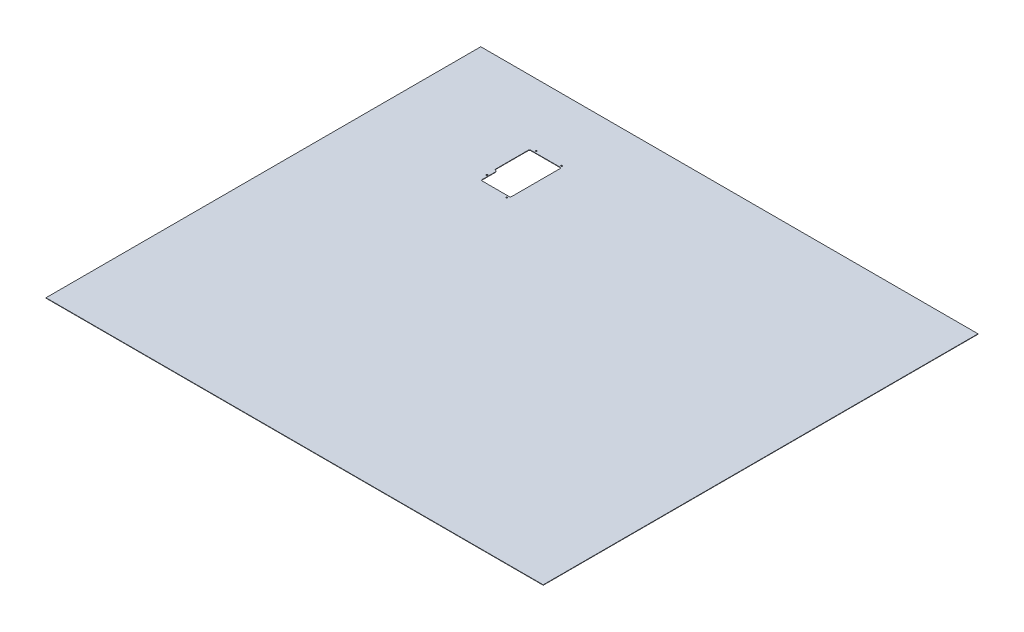
from build123d import *

# Parameters (mm, degrees)
SKETCH1_W           = 1250
SKETCH1_H           = 1093
BOSS_EXTRUDE1_DEPTH = 1
CUT_EXTRUDE1_DEPTH  = 10
FILLET2_R           = 3
SKETCH3_R           = 1.75
CUT_EXTRUDE2_DEPTH  = 10


with BuildPart() as part:
    # Sketch1 → Boss-Extrude1 (new body)
    with BuildSketch(Plane(origin=(0, 0, 0), x_dir=(1, 0, 0), z_dir=(0, 1, 0))):
        Rectangle(SKETCH1_W, SKETCH1_H)
    extrude(amount=BOSS_EXTRUDE1_DEPTH)

    # Sketch2 → Cut-Extrude1 (cut)
    with BuildSketch(Plane(origin=(0, 1, 0), x_dir=(1, 0, 0), z_dir=(0, 1, 0))):
        Polygon((-334, 256), (-260, 256), (-260, 384), (-340, 384), (-340, 296), (-334, 296), align=None)
    extrude(amount=-CUT_EXTRUDE1_DEPTH, mode=Mode.SUBTRACT)

    # Fillet2
    fillet2_edges = [part.edges().sort_by_distance(p)[0] for p in [
        (-260, 0.5, -256),
        (-334, 0.5, -256),
        (-334, 0.5, -296),
        (-340, 0.5, -296),
        (-340, 0.5, -384),
        (-260, 0.5, -384),
    ]]
    fillet(fillet2_edges, radius=FILLET2_R - 0.0001)  # a hair under: the kernel refuses the full size

    # Sketch3 → Cut-Extrude2 (cut)
    with BuildSketch(Plane(origin=(0, 1, 0), x_dir=(1, 0, 0), z_dir=(0, 1, 0))):
        with Locations(Location((-264, 389, 0), (0, 0, 270))):
            Circle(SKETCH3_R)
        with Locations(Location((-328, 389, 0), (0, 0, 270))):
            Circle(SKETCH3_R)
        with Locations(Location((-338, 275, 0), (0, 0, 270))):
            Circle(SKETCH3_R)
        with Locations(Location((-264, 251, 0), (0, 0, 270))):
            Circle(SKETCH3_R)
    extrude(amount=-CUT_EXTRUDE2_DEPTH, mode=Mode.SUBTRACT)


solid = part.part
